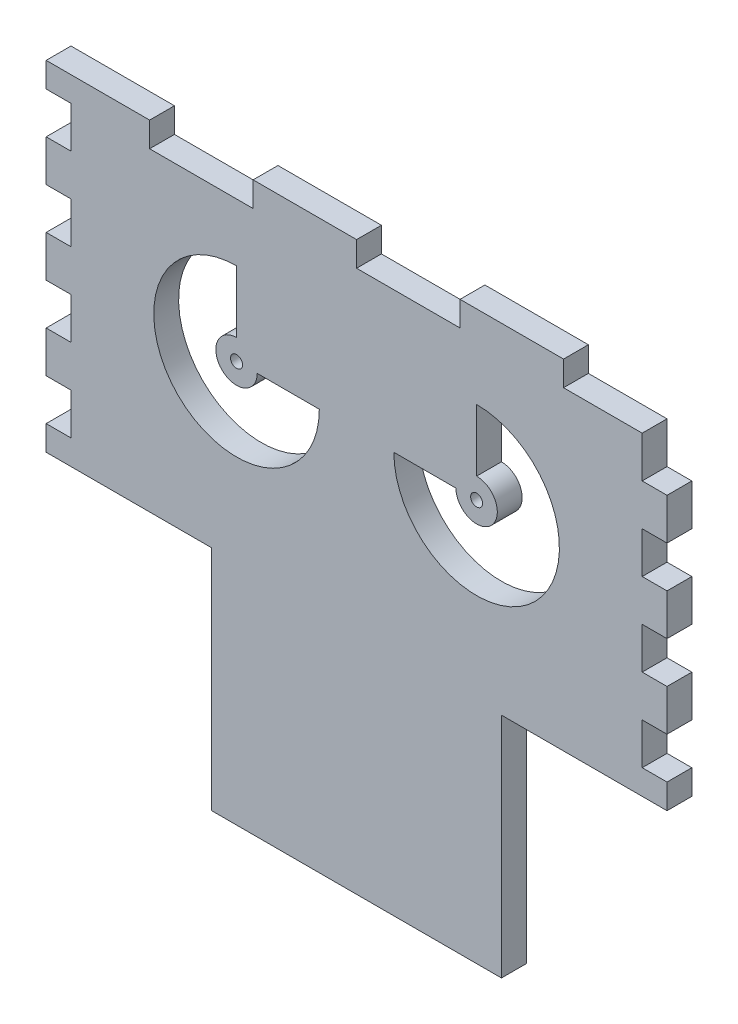
from build123d import *

# Parameters (mm, degrees)
BOSS_EXTRUDE1_DEPTH = 6
SKETCH2_W           = 6
SKETCH2_H           = 10
CUT_EXTRUDE1_DEPTH  = 10
SKETCH3_R           = 1.45
CUT_EXTRUDE2_DEPTH  = 6
SKETCH4_W           = 25
SKETCH4_H           = 6
CUT_EXTRUDE3_DEPTH  = 6


with BuildPart() as part:
    # Sketch1 → Boss-Extrude1 (new body)
    with BuildSketch(Plane.XY):
        Polygon((35, -41), (75, -41), (75, 41), (-75, 41), (-75, -41), (-35, -41), (-35, -96), (35, -96), align=None)
    extrude(amount=BOSS_EXTRUDE1_DEPTH)

    # Sketch2 → Cut-Extrude1 (cut)
    with BuildSketch(Plane.XY.offset(6)):
        with Locations((-72, 30)):
            Rectangle(SKETCH2_W, SKETCH2_H)
        with Locations((72, 30)):
            Rectangle(SKETCH2_W, SKETCH2_H)
        with Locations((72, 10)):
            Rectangle(SKETCH2_W, SKETCH2_H)
        with Locations((-72, 10)):
            Rectangle(SKETCH2_W, SKETCH2_H)
        with Locations((-72, -10)):
            Rectangle(SKETCH2_W, SKETCH2_H)
        with Locations((72, -10)):
            Rectangle(SKETCH2_W, SKETCH2_H)
        with Locations((-72, -30)):
            Rectangle(SKETCH2_W, SKETCH2_H)
        with Locations((72, -30)):
            Rectangle(SKETCH2_W, SKETCH2_H)
    extrude(amount=-CUT_EXTRUDE1_DEPTH, mode=Mode.SUBTRACT)

    # Sketch3 → Cut-Extrude2 (cut)
    with BuildSketch(Plane.XY.offset(6)):
        with Locations((-29, 1)):
            Circle(SKETCH3_R)
        with Locations((29, 1)):
            Circle(SKETCH3_R)
        with BuildLine():
            Line((-9, 1), (-24, 1))
            ThreePointArc((-24, 1), (-32.535533906, -2.535533906), (-29, 6))
            Line((-29, 6), (-29, 21))
            ThreePointArc((-29, 21), (-43.142135624, -13.142135624), (-9, 1))
        make_face()
        with BuildLine():
            Line((9, 1), (24, 1))
            ThreePointArc((24, 1), (32.535533906, -2.535533906), (29, 6))
            Line((29, 6), (29, 21))
            ThreePointArc((29, 21), (43.142135624, -13.142135624), (9, 1))
        make_face()
    extrude(amount=-CUT_EXTRUDE2_DEPTH, mode=Mode.SUBTRACT)

    # Sketch4 → Cut-Extrude3 (cut)
    with BuildSketch(Plane.XY.offset(6)):
        with Locations((12.5, 38)):
            Rectangle(SKETCH4_W, SKETCH4_H)
        with Locations((62.5, 38)):
            Rectangle(SKETCH4_W, SKETCH4_H)
        with Locations((-37.5, 38)):
            Rectangle(SKETCH4_W, SKETCH4_H)
    extrude(amount=-CUT_EXTRUDE3_DEPTH, mode=Mode.SUBTRACT)


solid = part.part
